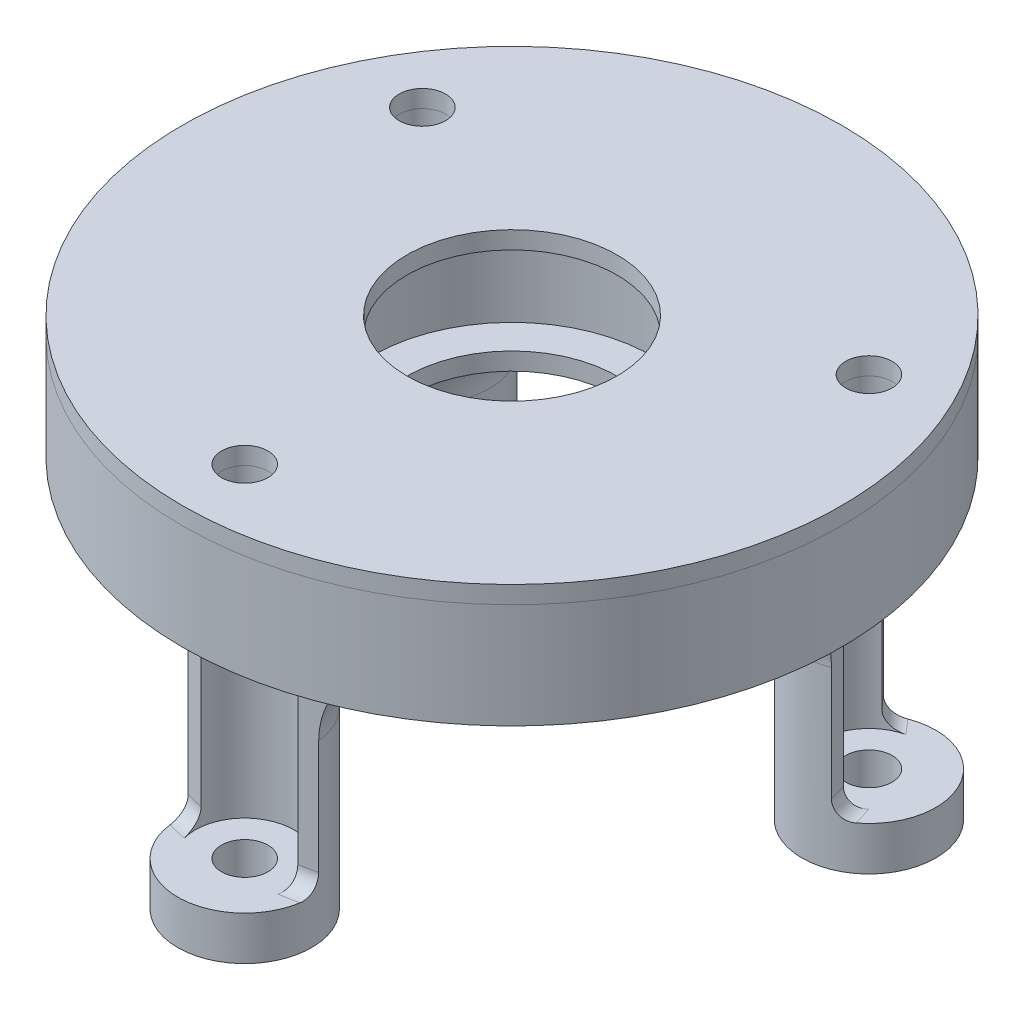
from build123d import *

# Parameters (mm, degrees)
SKETCH1_R             = 7.65
SKETCH1_R_2           = 2.65
BOSS_EXTRUDE1_DEPTH   = 5
BOSS_EXTRUDE1_2_DEPTH = 5
BOSS_EXTRUDE1_3_DEPTH = 5
BOSS_EXTRUDE2_DEPTH   = 30
SKETCH2_R             = 37.65
SKETCH2_R_2           = 16
BOSS_EXTRUDE3_DEPTH   = 12
SKETCH1_4_R           = 2.65
CUT_EXTRUDE1_DEPTH    = 42
SKETCH2_3_R           = 16
SKETCH2_3_R_2         = 12
BOSS_EXTRUDE4_DEPTH   = 2
SKETCH3_R             = 37.65
SKETCH3_R_2           = 12
SKETCH3_R_3           = 2.65
BOSS_EXTRUDE5_DEPTH   = 2
FILLET1_R             = 10
FILLET2_R             = 2


with BuildPart() as part:
    # Sketch1 → Boss-Extrude1 (new body)
    with BuildSketch(Plane(origin=(0, 0, 0), x_dir=(1, 0, 0), z_dir=(0, 1, 0))):
        with Locations(Location((-25.706110121, 15.465959473, 0), (0, 0, 270))):
            Circle(SKETCH1_R)
        with Locations(Location((-25.706110121, 15.465959473, 0), (0, 0, 270))):
            Circle(SKETCH1_R_2, mode=Mode.SUBTRACT)
    extrude(amount=BOSS_EXTRUDE1_DEPTH)



with BuildPart() as body_2:
    # Sketch1 → Boss-Extrude1 2 (new body)
    with BuildSketch(Plane(origin=(0, 0, 0), x_dir=(1, 0, 0), z_dir=(0, 1, 0))):
        with Locations(Location((26.246968858, 14.529164661, 0), (0, 0, 270))):
            Circle(SKETCH1_R)
        with Locations(Location((26.246968858, 14.529164661, 0), (0, 0, 270))):
            Circle(SKETCH1_R_2, mode=Mode.SUBTRACT)
    extrude(amount=BOSS_EXTRUDE1_2_DEPTH)


with BuildPart() as body_3:
    # Sketch1 → Boss-Extrude1 3 (new body)
    with BuildSketch(Plane(origin=(0, 0, 0), x_dir=(1, 0, 0), z_dir=(0, 1, 0))):
        with Locations(Location((-0.540858737, -29.995124134, 0), (0, 0, 270))):
            Circle(SKETCH1_R)
        with Locations(Location((-0.540858737, -29.995124134, 0), (0, 0, 270))):
            Circle(SKETCH1_R_2, mode=Mode.SUBTRACT)
    extrude(amount=BOSS_EXTRUDE1_3_DEPTH)


with BuildPart() as part_1:
    add(part.part)

    add(body_2.part)  # Boss-Extrude2 merges body 2

    add(body_3.part)  # Boss-Extrude2 merges body 3
    # Sketch1<3> → Boss-Extrude2 (add)
    with BuildSketch(Plane(origin=(0, 0, 0), x_dir=(1, 0, 0), z_dir=(0, 1, 0))):
        with BuildLine():
            ThreePointArc((21.718914877, 20.695137994), (19.5539918, 10.824227672), (29.06831369, 7.418432396))
            ThreePointArc((29.06831369, 7.418432396), (28.80318426, 8.389074827), (28.505653158, 9.350280106))
            ThreePointArc((28.505653158, 9.350280106), (21.303789723, 11.79283865), (23.057319156, 19.192707817))
            ThreePointArc((23.057319156, 19.192707817), (22.400716677, 19.955147014), (21.718914877, 20.695137994))
        make_face()
        with BuildLine():
            ThreePointArc((5.092712959, -29.56457804), (6.081305912, -29.377163212), (7.063057799, -29.156701023))
            ThreePointArc((7.063057799, -29.156701023), (-0.402939759, -22.34636748), (-8.109605934, -28.883114299))
            ThreePointArc((-8.109605934, -28.883114299), (-7.136440215, -29.138826693), (-6.155246475, -29.361759839))
            ThreePointArc((-6.155246475, -29.361759839), (-0.438997008, -24.346042422), (5.092712959, -29.56457804))
        make_face()
        with BuildLine():
            ThreePointArc((-28.781972676, 8.461563029), (-19.15105204, 11.522139808), (-20.958707756, 21.464681903))
            ThreePointArc((-20.958707756, 21.464681903), (-21.666744045, 20.749751866), (-22.350406683, 20.011479733))
            ThreePointArc((-22.350406683, 20.011479733), (-20.864792715, 12.553203773), (-28.150032115, 10.371870223))
            ThreePointArc((-28.150032115, 10.371870223), (-28.482022589, 9.422016198), (-28.781972676, 8.461563029))
        make_face()
    extrude(amount=BOSS_EXTRUDE2_DEPTH)

    # Sketch2 → Boss-Extrude3 (add)
    with BuildSketch(Plane(origin=(0, 30, 0), x_dir=(1, 0, 0), z_dir=(0, 1, 0))):
        with Locations(Location((0, 0, 0), (0, 0, 270))):
            Circle(SKETCH2_R)
        with Locations(Location((0, 0, 0), (0, 0, 270))):
            Circle(SKETCH2_R_2, mode=Mode.SUBTRACT)
    extrude(amount=BOSS_EXTRUDE3_DEPTH)

    # Sketch1<4> → Cut-Extrude1 (cut)
    with BuildSketch(Plane(origin=(0, 0, 0), x_dir=(1, 0, 0), z_dir=(0, 1, 0))):
        with Locations(Location((-25.706110121, 15.465959473, 0), (0, 0, 270))):
            Circle(SKETCH1_4_R)
        with Locations(Location((26.246968858, 14.529164661, 0), (0, 0, 270))):
            Circle(SKETCH1_4_R)
        with Locations(Location((-0.540858737, -29.995124134, 0), (0, 0, 270))):
            Circle(SKETCH1_4_R)
    extrude(amount=CUT_EXTRUDE1_DEPTH, mode=Mode.SUBTRACT)

    # Sketch2<3> → Boss-Extrude4 (add)
    with BuildSketch(Plane(origin=(0, 30, 0), x_dir=(1, 0, 0), z_dir=(0, 1, 0))):
        with Locations(Location((0, 0, 0), (0, 0, 270))):
            Circle(SKETCH2_3_R)
        with Locations(Location((0, 0, 0), (0, 0, 270))):
            Circle(SKETCH2_3_R_2, mode=Mode.SUBTRACT)
    extrude(amount=BOSS_EXTRUDE4_DEPTH)

    # Fillet1
    fillet1_edges = [part_1.edges().sort_by_distance(p)[0] for p in [
        (-19.15105204, 30, -11.522139808),
        (-0.402939759, 30, 22.34636748),
        (19.5539918, 30, -10.824227672),
    ]]
    fillet(fillet1_edges, radius=FILLET1_R)

    # Fillet2
    # the kernel refuses this fillet: 2 mm, written as the material it adds along each edge
    with BuildSketch(Plane(origin=(0, 5, 0), x_dir=(-0.9928962854654476, 0, -0.11898305051105518), z_dir=(-0.11898305051105518, 0, 0.9928962854654476))) as fillet2_piece_1_section:
        with BuildLine():
            CenterArc((30 + FILLET2_R, -FILLET2_R), FILLET2_R, 90, 90)
            Line((30, -FILLET2_R), (30, 0))
            Line((30, 0), (30 + FILLET2_R, 0))
        make_face()
    fillet2_piece_1 = revolve(axis=Axis((0, 5, 0), (0, -1, 0)), revolution_arc=22.942191835, mode=Mode.PRIVATE)
    fillet2_piece_1 = fillet2_piece_1 & Plane(origin=(-25.706110121, 5.449479816, -15.465959473), x_dir=(0, 0, 1), z_dir=(0, -1, 0)) * Cylinder(7.65, 129, mode=Mode.PRIVATE)
    fillet2_piece_1 = fillet2_piece_1 - Plane(origin=(-25.706110121, 5.449479816, -15.465959473), x_dir=(0.5939298121240703, 0, -0.8045168601528913), z_dir=(0, -1, 0)) * Cylinder(5.65, 129, mode=Mode.PRIVATE)
    add(fillet2_piece_1)
    with BuildSketch(Plane(origin=(0, 5, 0), x_dir=(-0.8453510442178569, 0, -0.5342112054607044), z_dir=(-0.5342112054607044, 0, 0.8453510442178569))) as fillet2_piece_2_section:
        with BuildLine():
            CenterArc((30 + FILLET2_R, -FILLET2_R), FILLET2_R, 90, 90)
            Line((30, -FILLET2_R), (30, 0))
            Line((30, 0), (30 + FILLET2_R, 0))
        make_face()
    fillet2_piece_2 = revolve(axis=Axis((0, 5, 0), (0, -1, 0)), revolution_arc=22.942191835, mode=Mode.PRIVATE)
    fillet2_piece_2 = fillet2_piece_2 & Plane(origin=(-25.706110121, 5.449479588, -15.465959473), x_dir=(0, 0, 1), z_dir=(0, -1, 0)) * Cylinder(7.65, 128, mode=Mode.PRIVATE)
    fillet2_piece_2 = fillet2_piece_2 - Plane(origin=(-25.706110121, 5.449479588, -15.465959473), x_dir=(0.5939298121240703, 0, -0.8045168601528913), z_dir=(0, -1, 0)) * Cylinder(5.65, 128, mode=Mode.PRIVATE)
    add(fillet2_piece_2)
    with BuildSketch(Plane(origin=(0, 5, 0), x_dir=(0.3934057983704155, 0, 0.9193649317917972), z_dir=(0.9193649317917972, 0, -0.3934057983704155))) as fillet2_piece_3_section:
        with BuildLine():
            CenterArc((30 + FILLET2_R, -FILLET2_R), FILLET2_R, 90, 90)
            Line((30, -FILLET2_R), (30, 0))
            Line((30, 0), (30 + FILLET2_R, 0))
        make_face()
    fillet2_piece_3 = revolve(axis=Axis((0, 5, 0), (0, -1, 0)), revolution_arc=22.942191835, mode=Mode.PRIVATE)
    fillet2_piece_3 = fillet2_piece_3 & Plane(origin=(-0.540858737, 5.449479816, 29.995124134), x_dir=(0, 0, 1), z_dir=(0, -1, 0)) * Cylinder(7.65, 128, mode=Mode.PRIVATE)
    fillet2_piece_3 = fillet2_piece_3 - Plane(origin=(-0.540858737, 5.449479816, 29.995124134), x_dir=(-0.9936969447273312, 0, -0.11209987528792113), z_dir=(0, -1, 0)) * Cylinder(5.65, 128, mode=Mode.PRIVATE)
    add(fillet2_piece_3)
    with BuildSketch(Plane(origin=(0, 5, 0), x_dir=(-0.03996495280640961, 0, 0.9992010821387162), z_dir=(0.9992010821387162, 0, 0.03996495280640961))) as fillet2_piece_4_section:
        with BuildLine():
            CenterArc((30 + FILLET2_R, -FILLET2_R), FILLET2_R, 90, 90)
            Line((30, -FILLET2_R), (30, 0))
            Line((30, 0), (30 + FILLET2_R, 0))
        make_face()
    fillet2_piece_4 = revolve(axis=Axis((0, 5, 0), (0, -1, 0)), revolution_arc=22.942191835, mode=Mode.PRIVATE)
    fillet2_piece_4 = fillet2_piece_4 & Plane(origin=(-0.540858737, 5.449479588, 29.995124134), x_dir=(0, 0, 1), z_dir=(0, -1, 0)) * Cylinder(7.65, 129, mode=Mode.PRIVATE)
    fillet2_piece_4 = fillet2_piece_4 - Plane(origin=(-0.540858737, 5.449479588, 29.995124134), x_dir=(-0.9936969447273312, 0, -0.11209987528792113), z_dir=(0, -1, 0)) * Cylinder(5.65, 129, mode=Mode.PRIVATE)
    add(fillet2_piece_4)
    with BuildSketch(Plane(origin=(0, 5, 0), x_dir=(0.599490487095163, 0, -0.8003818812806823), z_dir=(-0.8003818812806823, 0, -0.599490487095163))) as fillet2_piece_5_section:
        with BuildLine():
            CenterArc((30 + FILLET2_R, -FILLET2_R), FILLET2_R, 90, 90)
            Line((30, -FILLET2_R), (30, 0))
            Line((30, 0), (30 + FILLET2_R, 0))
        make_face()
    fillet2_piece_5 = revolve(axis=Axis((0, 5, 0), (0, -1, 0)), revolution_arc=22.942191835, mode=Mode.PRIVATE)
    fillet2_piece_5 = fillet2_piece_5 & Plane(origin=(26.246968858, 5.449479816, -14.529164661), x_dir=(0, 0, 1), z_dir=(0, -1, 0)) * Cylinder(7.65, 129, mode=Mode.PRIVATE)
    fillet2_piece_5 = fillet2_piece_5 - Plane(origin=(26.246968858, 5.449479816, -14.529164661), x_dir=(0.39976713260322355, 0, 0.9166167354408258), z_dir=(0, -1, 0)) * Cylinder(5.65, 129, mode=Mode.PRIVATE)
    add(fillet2_piece_5)
    with BuildSketch(Plane(origin=(0, 5, 0), x_dir=(0.8853159970242256, 0, -0.464989876677978), z_dir=(-0.464989876677978, 0, -0.8853159970242256))) as fillet2_piece_6_section:
        with BuildLine():
            CenterArc((30 + FILLET2_R, -FILLET2_R), FILLET2_R, 90, 90)
            Line((30, -FILLET2_R), (30, 0))
            Line((30, 0), (30 + FILLET2_R, 0))
        make_face()
    fillet2_piece_6 = revolve(axis=Axis((0, 5, 0), (0, -1, 0)), revolution_arc=22.942191835, mode=Mode.PRIVATE)
    fillet2_piece_6 = fillet2_piece_6 & Plane(origin=(26.246968858, 5.449479588, -14.529164661), x_dir=(0, 0, 1), z_dir=(0, -1, 0)) * Cylinder(7.65, 128, mode=Mode.PRIVATE)
    fillet2_piece_6 = fillet2_piece_6 - Plane(origin=(26.246968858, 5.449479588, -14.529164661), x_dir=(0.39976713260322355, 0, 0.9166167354408258), z_dir=(0, -1, 0)) * Cylinder(5.65, 128, mode=Mode.PRIVATE)
    add(fillet2_piece_6)


with BuildPart() as body_2_2:
    # Sketch3 → Boss-Extrude5 (new body)
    with BuildSketch(Plane(origin=(0, 42, 0), x_dir=(1, 0, 0), z_dir=(0, 1, 0))):
        with Locations(Location((0, 0, 0), (0, 0, 270))):
            Circle(SKETCH3_R)
        with Locations(Location((0, 0, 0), (0, 0, 270))):
            Circle(SKETCH3_R_2, mode=Mode.SUBTRACT)
        with Locations(Location((-0.540858737, -29.995124134, 0), (0, 0, 270))):
            Circle(SKETCH3_R_3, mode=Mode.SUBTRACT)
        with Locations(Location((26.246968858, 14.529164661, 0), (0, 0, 270))):
            Circle(SKETCH3_R_3, mode=Mode.SUBTRACT)
        with Locations(Location((-25.706110121, 15.465959473, 0), (0, 0, 270))):
            Circle(SKETCH3_R_3, mode=Mode.SUBTRACT)
    extrude(amount=BOSS_EXTRUDE5_DEPTH)


solid = Compound([part_1.part, body_2_2.part])
